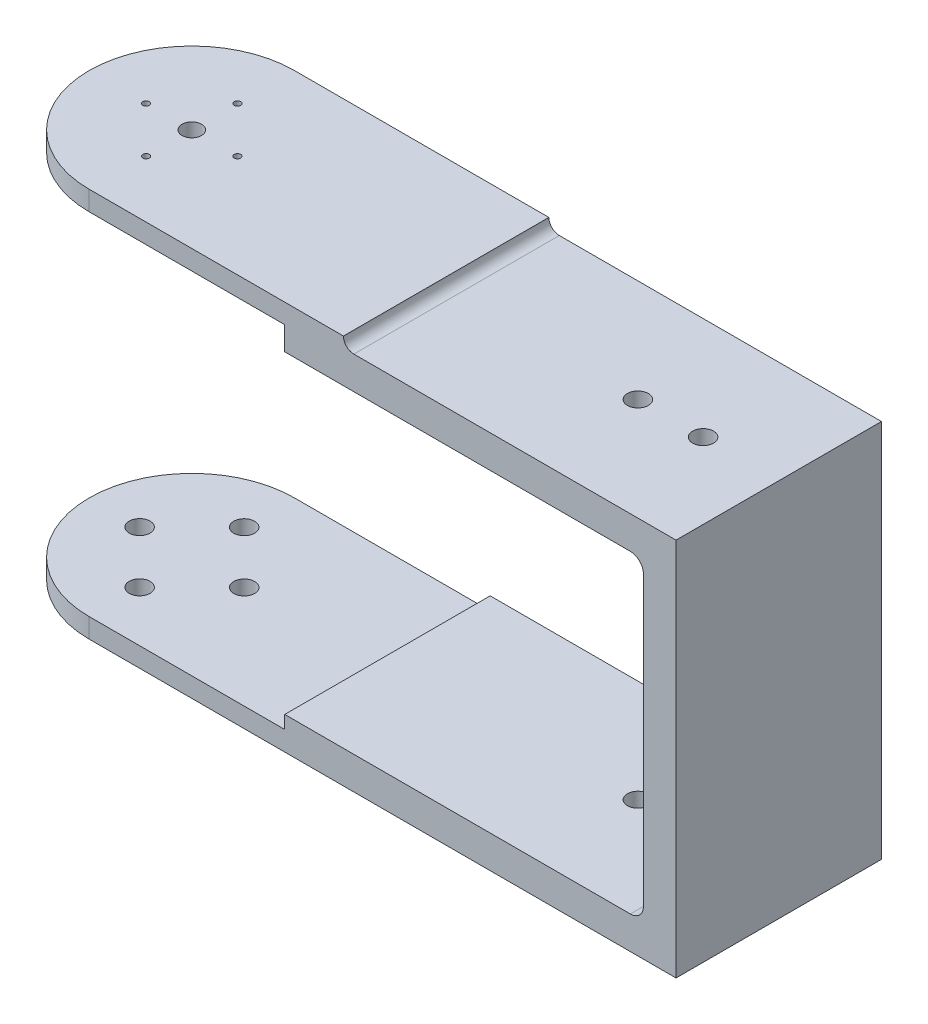
from build123d import *

# Parameters (mm, degrees)
EXTRUDE_1_DEPTH     = 3
SKETCH_3_W          = 60
SKETCH_3_H          = 31.5
EXTRUDE_2_DEPTH     = 2
SKETCH_4_R          = 0.5
CUT_EXTRUDE_1_DEPTH = 10
SKETCH_5_R          = 1.5
CUT_EXTRUDE_2_DEPTH = 10
SKETCH_6_W          = 5
SKETCH_6_H          = 31.5
EXTRUDE_3_DEPTH     = 48.15
EXTRUDE_START       = 5
SKETCH_7_R          = 1.6
EXTRUDE_4_DEPTH     = 5
CUT_EXTRUDE_3_DEPTH = 2
FILLET_1_R          = 2
FILLET_2_R          = 2
CUT_EXTRUDE_5_DEPTH = 1.6
SKETCH_11_R         = 0.5
SKETCH_11_R_2       = 1.5
EXTRUDE_5_DEPTH     = 3
SKETCH_12_W         = 31.5
SKETCH_12_H         = 1.6
EXTRUDE_6_DEPTH     = 9
FILLET_4_R          = 1.6
EXTRUDE_START_2     = 1.6
SKETCH_13_R         = 10
SKETCH_13_R_2       = 1.75
SKETCH_13_R_3       = 0.5
EXTRUDE_7_DEPTH     = 1.6
SKETCH_14_R         = 1.6
CUT_EXTRUDE_6_DEPTH = 67.6


with BuildPart() as part:
    # 草图1 → 凸台-拉伸1 (new body)
    with BuildSketch(Plane(origin=(0, 0, 0), x_dir=(1, 0, 0), z_dir=(0, 1, 0))):
        with BuildLine():
            Line((0, -15.75), (90, -15.75))
            Line((90, -15.75), (90, 15.75))
            Line((90, 15.75), (0, 15.75))
            ThreePointArc((0, 15.75), (-15.75, 0), (0, -15.75))
        make_face()
    extrude(amount=EXTRUDE_1_DEPTH)

    # 草图3 → 凸台-拉伸2 (add)
    with BuildSketch(Plane.XZ):
        with Locations((60, 0)):
            Rectangle(SKETCH_3_W, SKETCH_3_H)
    extrude(amount=EXTRUDE_2_DEPTH)

    # 草图4 → 切除-拉伸1 (cut)
    with BuildSketch(Plane.XZ):
        with Locations(Location((0, 7, 0), (0, 0, 270))):
            Circle(SKETCH_4_R)
        with Locations(Location((7, 0, 0), (0, 0, 270))):
            Circle(SKETCH_4_R)
        with Locations(Location((0, -7, 0), (0, 0, 270))):
            Circle(SKETCH_4_R)
        with Locations(Location((-7, 0, 0), (0, 0, 270))):
            Circle(SKETCH_4_R)
    extrude(amount=-CUT_EXTRUDE_1_DEPTH, mode=Mode.SUBTRACT)

    # 草图5 → 切除-拉伸2 (cut)
    with BuildSketch(Plane(origin=(0, 3, 0), x_dir=(1, 0, 0), z_dir=(0, 1, 0))):
        with Locations(Location((0, 0, 0), (0, 0, 270))):
            Circle(SKETCH_5_R)
    extrude(amount=-CUT_EXTRUDE_2_DEPTH, mode=Mode.SUBTRACT)

    # 草图6 → 凸台-拉伸3 (add)
    with BuildSketch(Plane.XZ.offset(2)):
        with Locations((87.5, 0)):
            Rectangle(SKETCH_6_W, SKETCH_6_H)
    extrude(amount=EXTRUDE_3_DEPTH)

    # 草图7 → 凸台-拉伸4 (add)
    with BuildSketch(Plane.XZ.offset(50.15).offset(EXTRUDE_START)):
        with BuildLine():
            Line((90, 15.75), (0, 15.75))
            ThreePointArc((0, 15.75), (-15.75, 0), (0, -15.75))
            Line((0, -15.75), (90, -15.75))
            Line((90, -15.75), (90, 15.75))
        make_face()
        with Locations(Location((8.03393099, 0, 0), (0, 0, 270))):
            Circle(SKETCH_7_R, mode=Mode.SUBTRACT)
        with Locations(Location((0, 8, 0), (0, 0, 270))):
            Circle(SKETCH_7_R, mode=Mode.SUBTRACT)
        with Locations(Location((0.03393099, -7.999928043, 0), (0, 0, 270))):
            Circle(SKETCH_7_R, mode=Mode.SUBTRACT)
        with Locations(Location((-8, 0, 0), (0, 0, 270))):
            Circle(SKETCH_7_R, mode=Mode.SUBTRACT)
    extrude(amount=-EXTRUDE_4_DEPTH)

    # 草图8 → 切除-拉伸3 (cut)
    with BuildSketch(Plane(origin=(0, -50.15, 0), x_dir=(1, 0, 0), z_dir=(0, 1, 0))):
        Polygon((0, 15.75), (30, 15.75), (30, -15.75), (0, -15.75), (-20, -15.75), (-20, 15.75), align=None)
    extrude(amount=-CUT_EXTRUDE_3_DEPTH, mode=Mode.SUBTRACT)

    # 圆角1
    fillet_1_edges = [part.edges().sort_by_distance(p)[0] for p in [
        (85, -2, 0),
    ]]
    fillet(fillet_1_edges, radius=FILLET_1_R)

    # 圆角2
    fillet_2_edges = [part.edges().sort_by_distance(p)[0] for p in [
        (85, -50.15, 0),
    ]]
    fillet(fillet_2_edges, radius=FILLET_2_R)

    # 草图10 → 切除-拉伸5 (cut)
    with BuildSketch(Plane.XZ):
        with BuildLine():
            Line((30, -15.75), (30, 15.75))
            Line((30, 15.75), (0, 15.75))
            ThreePointArc((0, 15.75), (-15.75, 0), (0, -15.75))
            Line((0, -15.75), (30, -15.75))
        make_face()
    extrude(amount=-CUT_EXTRUDE_5_DEPTH, mode=Mode.SUBTRACT)

    # 草图11 → 凸台-拉伸5 (add)
    with BuildSketch(Plane.XZ.offset(-1.6)):
        with BuildLine():
            Line((0, -15.75), (30, -15.75))
            Line((30, -15.75), (30, 15.75))
            Line((30, 15.75), (0, 15.75))
            ThreePointArc((0, 15.75), (-15.75, 0), (0, -15.75))
        make_face()
        with Locations(Location((0, -7, 0), (0, 0, 270))):
            Circle(SKETCH_11_R, mode=Mode.SUBTRACT)
        with Locations(Location((-7, 0, 0), (0, 0, 270))):
            Circle(SKETCH_11_R, mode=Mode.SUBTRACT)
        with Locations(Location((0, 0, 0), (0, 0, 270))):
            Circle(SKETCH_11_R_2, mode=Mode.SUBTRACT)
        with Locations(Location((0, 7, 0), (0, 0, 270))):
            Circle(SKETCH_11_R, mode=Mode.SUBTRACT)
        with Locations(Location((7, 0, 0), (0, 0, 270))):
            Circle(SKETCH_11_R, mode=Mode.SUBTRACT)
    extrude(amount=-EXTRUDE_5_DEPTH)

    # 草图12 → 凸台-拉伸6 (add)
    with BuildSketch(Plane(origin=(30, 0, 0), x_dir=(0, 0, -1), z_dir=(1, 0, 0))):
        with Locations((0, 3.8)):
            Rectangle(SKETCH_12_W, SKETCH_12_H)
    extrude(amount=EXTRUDE_6_DEPTH)

    # 圆角4
    fillet_4_edges = [part.edges().sort_by_distance(p)[0] for p in [
        (39, 3, 0),
    ]]
    fillet(fillet_4_edges, radius=FILLET_4_R - 0.0001)  # a hair under: the kernel refuses the full size

    # 草图13 → 凸台-拉伸7 (add)
    with BuildSketch(Plane.XZ.offset(-1.6).offset(EXTRUDE_START_2)):
        with Locations(Location((0, 0, 0), (0, 0, 270))):
            Circle(SKETCH_13_R)
        with Locations(Location((0, 0, 0), (0, 0, 270))):
            Circle(SKETCH_13_R_2, mode=Mode.SUBTRACT)
        with Locations(Location((7, 0, 0), (0, 0, 270))):
            Circle(SKETCH_13_R_3, mode=Mode.SUBTRACT)
        with Locations(Location((0, -7, 0), (0, 0, 270))):
            Circle(SKETCH_13_R_3, mode=Mode.SUBTRACT)
        with Locations(Location((-7, 0, 0), (0, 0, 270))):
            Circle(SKETCH_13_R_3, mode=Mode.SUBTRACT)
        with Locations(Location((0, 7, 0), (0, 0, 270))):
            Circle(SKETCH_13_R_3, mode=Mode.SUBTRACT)
    extrude(amount=-EXTRUDE_7_DEPTH)

    # 草图14 → 切除-拉伸6 (cut)
    with BuildSketch(Plane.XZ.offset(55.15)):
        with Locations(Location((68.4, 0, 0), (0, 0, 270))):
            Circle(SKETCH_14_R)
        with Locations(Location((78.4, 0, 0), (0, 0, 270))):
            Circle(SKETCH_14_R)
    extrude(amount=-CUT_EXTRUDE_6_DEPTH, mode=Mode.SUBTRACT)


solid = part.part
